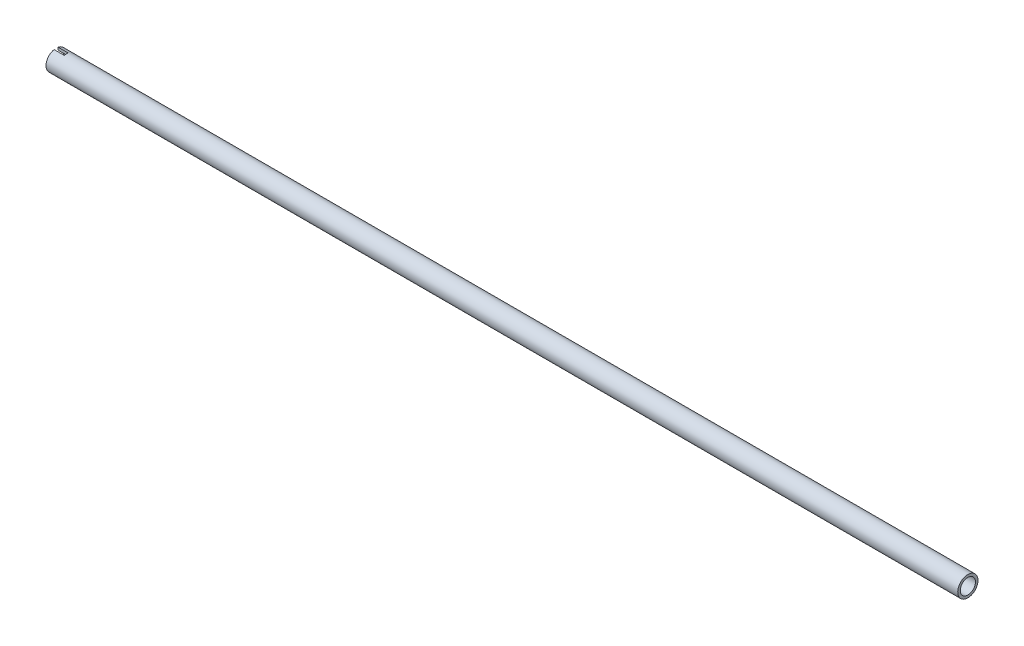
from build123d import *

# Parameters (mm, degrees)
SKETCH1_R           = 1
SKETCH1_R_2         = 0.75
BOSS_EXTRUDE1_DEPTH = 90
CUT_EXTRUDE1_DEPTH  = 1


with BuildPart() as part:
    # Sketch1 → Boss-Extrude1 (new body)
    with BuildSketch(Plane(origin=(0, 0, 0), x_dir=(0, 0, -1), z_dir=(1, 0, 0))):
        Circle(SKETCH1_R)
        Circle(SKETCH1_R_2, mode=Mode.SUBTRACT)
    extrude(amount=BOSS_EXTRUDE1_DEPTH)

    # Sketch2 → Cut-Extrude1 (cut)
    with BuildSketch(Plane.ZY):
        with BuildLine():
            Line((-0.2, 0.610565492), (-0.2, 1.099202537))
            Line((-0.2, 1.099202537), (0.2, 1.099202537))
            Line((0.2, 1.099202537), (0.2, 0.610565492))
            ThreePointArc((0.2, 0.610565492), (0, 0.410565492), (-0.2, 0.610565492))
        make_face()
    extrude(amount=-CUT_EXTRUDE1_DEPTH, mode=Mode.SUBTRACT)


solid = part.part
